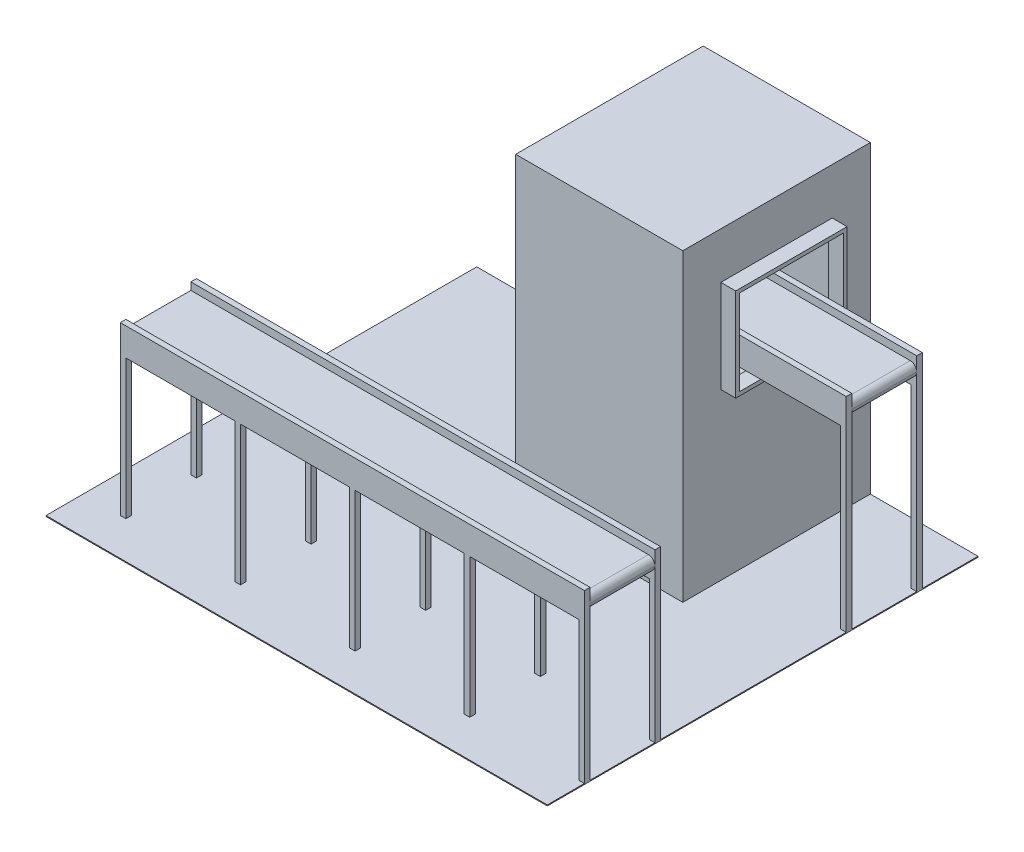
from build123d import *

# Parameters (mm, degrees)
SKETCH1_W             = 30
SKETCH1_H             = 550
SKETCH1_H_2           = 400
SKETCH1_H_3           = 150
SKETCH1_H_4           = 800
BOSS_EXTRUDE5_DEPTH   = 30
BOSS_EXTRUDE6_DEPTH   = 500
BOSS_EXTRUDE7_DEPTH   = 2500
SKETCH2_W             = 560
SKETCH2_H             = 460
BOSS_EXTRUDE8_DEPTH   = 80
BOSS_EXTRUDE10_DEPTH  = 900
SKETCH6_4_OUTSIDE_W   = 2855.048
SKETCH6_4_OUTSIDE_H   = 2375.048
SKETCH6_4_OUTSIDE_W_2 = 600
SKETCH6_4_OUTSIDE_H_2 = 500
CUT_EXTRUDE2_DEPTH    = 3298.028965599
FILLET1_R             = 35
FILLET2_R             = 35
BOSS_EXTRUDE11_DEPTH  = 1000
SKETCH19_W            = 587.5
SKETCH19_H            = 750
CUT_EXTRUDE3_DEPTH    = 2000
SKETCH20_W            = 900
SKETCH20_H            = 1010
BOSS_EXTRUDE12_DEPTH  = 5


with BuildPart() as part:
    # Sketch1 → Boss-Extrude5 (new body)
    with BuildSketch(Plane(origin=(0, 0, 0), x_dir=(0, 0, -1), z_dir=(1, 0, 0))):
        with Locations((1805, 275)):
            Rectangle(SKETCH1_W, SKETCH1_H)
        with Locations((1805, 750)):
            Rectangle(SKETCH1_W, SKETCH1_H_2)
        with Locations((1425, 875)):
            Rectangle(SKETCH1_W, SKETCH1_H_3)
        with Locations((1425, 400)):
            Rectangle(SKETCH1_W, SKETCH1_H_4)
    extrude(amount=-BOSS_EXTRUDE5_DEPTH)

    # Sketch1<10> → Boss-Extrude6 (add)
    with BuildSketch(Plane(origin=(0, 0, 0), x_dir=(0, 0, -1), z_dir=(1, 0, 0))):
        Polygon((1410, 950), (1440, 950), (1440, 990), (1440, 1060), (1440, 1100), (1410, 1100), align=None)
        Polygon((1440, 1060), (1440, 990), (1615, 990), (1790, 990), (1790, 1060), (1615, 1060), align=None)
        Polygon((1790, 990), (1790, 950), (1820, 950), (1820, 1100), (1790, 1100), (1790, 1060), align=None)
    extrude(amount=-BOSS_EXTRUDE6_DEPTH)

    # Fillet1
    fillet1_edges = [part.edges().sort_by_distance(p)[0] for p in [
        (0, 1060, -1615),
        (0, 990, -1615),
    ]]
    fillet(fillet1_edges, radius=FILLET1_R - 0.0001)  # a hair under: the kernel refuses the full size

    # Sketch17 → Boss-Extrude11 (add)
    with BuildSketch(Plane.ZY.offset(500)):
        Polygon((-1615, 1060), (-1440, 1060), (-1440, 1100), (-1410, 1100), (-1410, 950), (-1440, 950), (-1440, 990), (-1790, 990), (-1790, 950), (-1820, 950), (-1820, 1100), (-1790, 1100), (-1790, 1060), align=None)
    extrude(amount=BOSS_EXTRUDE11_DEPTH)



with BuildPart() as body_2:
    # Sketch1<11> → Boss-Extrude7 (new body)
    with BuildSketch(Plane(origin=(0, 0, 0), x_dir=(0, 0, -1), z_dir=(1, 0, 0))):
        Polygon((380, 0), (410, 0), (410, 750), (380, 750), (380, 375), align=None)
        Polygon((0, 0), (30, 0), (30, 450), (30, 750), (0, 750), align=None)
        Polygon((30, 860), (30, 900), (0, 900), (0, 750), (30, 750), (30, 790), align=None)
        Polygon((205, 790), (380, 790), (380, 860), (205, 860), (30, 860), (30, 790), align=None)
        Polygon((380, 750), (410, 750), (410, 900), (380, 900), (380, 860), (380, 790), align=None)
    extrude(amount=-BOSS_EXTRUDE7_DEPTH)

    # Fillet2
    fillet2_edges = [body_2.edges().sort_by_distance(p)[0] for p in [
        (0, 790, -205),
        (0, 860, -205),
    ]]
    fillet(fillet2_edges, radius=FILLET2_R - 0.0001)  # a hair under: the kernel refuses the full size

    # Sketch19 → Cut-Extrude3 (cut)
    with BuildSketch(Plane(origin=(0, 0, -410), x_dir=(-1, 0, 0), z_dir=(0, 0, -1))):
        with Locations((323.75, 375)):
            Rectangle(SKETCH19_W, SKETCH19_H)
        with Locations((941.25, 375)):
            Rectangle(SKETCH19_W, SKETCH19_H)
        with Locations((1558.75, 375)):
            Rectangle(SKETCH19_W, SKETCH19_H)
        with Locations((2176.25, 375)):
            Rectangle(SKETCH19_W, SKETCH19_H)
    extrude(amount=-CUT_EXTRUDE3_DEPTH, mode=Mode.SUBTRACT)


with BuildPart() as body_3:
    # Sketch2 → Boss-Extrude8 (new body)
    with BuildSketch(Plane.ZY.offset(500)):
        Polygon((-1615, 890), (-1315, 890), (-1315, 1390), (-1915, 1390), (-1915, 890), align=None)
        with Locations((-1615, 1140)):
            Rectangle(SKETCH2_W, SKETCH2_H, mode=Mode.SUBTRACT)
    extrude(amount=BOSS_EXTRUDE8_DEPTH)

    # Sketch6 → Boss-Extrude10 (add)
    with BuildSketch(Plane.ZY.offset(580)):
        Polygon((-1110, 1140), (-1110, 1640), (-2120, 1640), (-2120, 0), (-1110, 0), align=None)
    extrude(amount=BOSS_EXTRUDE10_DEPTH)

    # Sketch6<4> outside → Cut-Extrude2 (cut, through all)
    # profile 1 of 2: a face of its own
    with BuildSketch(Plane.ZY.offset(580)):
        with Locations((-1060, 820)):
            Rectangle(SKETCH6_4_OUTSIDE_W, SKETCH6_4_OUTSIDE_H)
        Polygon((-1110, 1140), (-1110, 1640), (-2120, 1640), (-2120, 0), (-1110, 0), align=None, mode=Mode.SUBTRACT)
    # profile 2 of 2: a face of its own
    with BuildSketch(Plane.ZY.offset(580)):
        with Locations((-1615, 1140)):
            Rectangle(SKETCH6_4_OUTSIDE_W_2, SKETCH6_4_OUTSIDE_H_2)
    extrude(amount=CUT_EXTRUDE2_DEPTH, mode=Mode.SUBTRACT)


with BuildPart() as cut_extrude2_piece_1:
    # of the separate pieces the step leaves, piece 1, a body of its own (cut_extrude2_pieces)
    add(body_3.part.solids().sort_by_distance((-580, 1640, -1110))[0])


with BuildPart() as cut_extrude2_piece_2:
    # of the separate pieces the step leaves, piece 2, a body of its own (cut_extrude2_pieces)
    add(body_3.part.solids().sort_by_distance((-500, 890, -1315))[0])


with BuildPart() as part_1:
    add(part.part)

    add(body_2.part)  # Boss-Extrude12 merges body 2

    add(cut_extrude2_piece_1.part)  # Boss-Extrude12 merges Cut-Extrude2 piece 1
    # Sketch20 → Boss-Extrude12 (add)
    with BuildSketch(Plane.XZ):
        Polygon((0, -1820), (0, 0), (0, 200), (-2700, 200), (-2700, -2120), (-1480, -2120), (-1480, -1110), (-580, -1110), (-580, -2120), (0, -2120), align=None)
        with Locations((-1030, -1615)):
            Rectangle(SKETCH20_W, SKETCH20_H)
    extrude(amount=BOSS_EXTRUDE12_DEPTH)


solid = Compound([cut_extrude2_piece_2.part, part_1.part])
